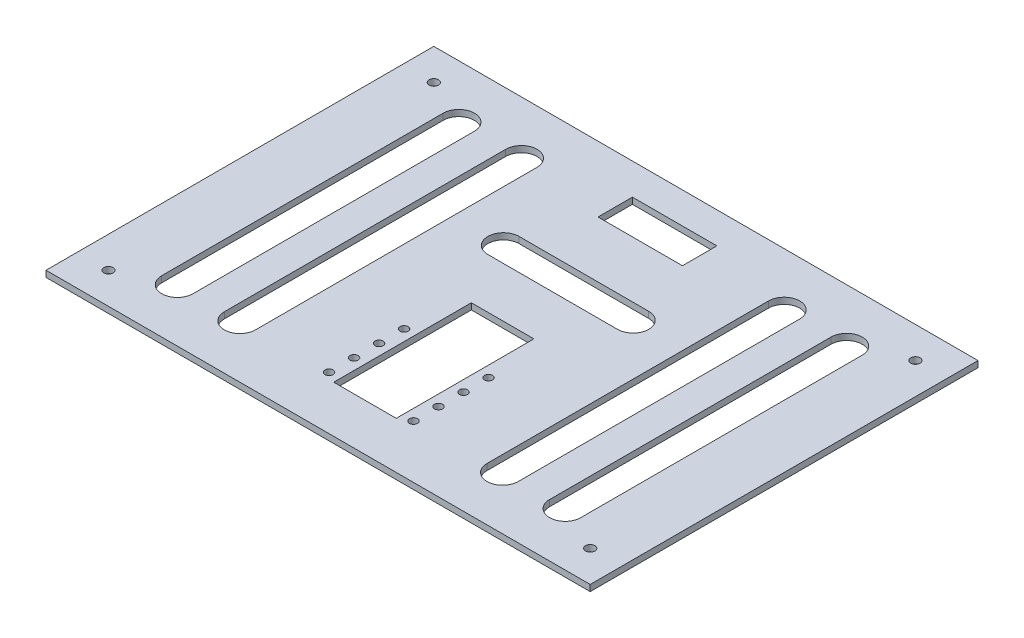
from build123d import *

# Parameters (mm, degrees)
ESBO_O1_W                = 174
ESBO_O1_H                = 124
ESBO_O1_R                = 1.5
RESSALTO_EXTRUS_O1_DEPTH = 2
ESBO_O2_R                = 1.3
ESBO_O2_W                = 20
ESBO_O2_H                = 44
ESBO_O2_W_2              = 27
ESBO_O2_H_2              = 11
CORTE_EXTRUS_O1_DEPTH    = 2


with BuildPart() as part:
    # Esboço1 → Ressalto-extrusão1 (new body)
    with BuildSketch(Plane(origin=(0, 0, 0), x_dir=(1, 0, 0), z_dir=(0, 1, 0))):
        Rectangle(ESBO_O1_W, ESBO_O1_H)
        with Locations(Location((-77, 52, 0), (0, 0, 270))):
            Circle(ESBO_O1_R, mode=Mode.SUBTRACT)
        with Locations(Location((-77, -52, 0), (0, 0, 270))):
            Circle(ESBO_O1_R, mode=Mode.SUBTRACT)
        with Locations(Location((77, -52, 0), (0, 0, 270))):
            Circle(ESBO_O1_R, mode=Mode.SUBTRACT)
        with Locations(Location((77, 52, 0), (0, 0, 270))):
            Circle(ESBO_O1_R, mode=Mode.SUBTRACT)
    extrude(amount=RESSALTO_EXTRUS_O1_DEPTH)

    # Esboço2 → Corte-extrusão1 (cut)
    with BuildSketch(Plane(origin=(0, 2, 0), x_dir=(1, 0, 0), z_dir=(0, 1, 0))):
        with Locations(Location((-13.5, -21, 0), (0, 0, 270))):
            Circle(ESBO_O2_R)
        with Locations(Location((-13.5, -29, 0), (0, 0, 270))):
            Circle(ESBO_O2_R)
        with Locations(Location((-13.5, -37, 0), (0, 0, 270))):
            Circle(ESBO_O2_R)
        with Locations(Location((-13.5, -45, 0), (0, 0, 270))):
            Circle(ESBO_O2_R)
        with Locations(Location((13.5, -37, 0), (0, 0, 90))):
            Circle(ESBO_O2_R)
        with Locations(Location((13.5, -45, 0), (0, 0, 90))):
            Circle(ESBO_O2_R)
        with Locations(Location((13.5, -29, 0), (0, 0, 90))):
            Circle(ESBO_O2_R)
        with Locations(Location((13.5, -21, 0), (0, 0, 90))):
            Circle(ESBO_O2_R)
        with Locations((0, -25)):
            Rectangle(ESBO_O2_W, ESBO_O2_H)
        with BuildLine():
            Line((-37, 45), (-37, -45))
            ThreePointArc((-37, -45), (-42, -50), (-47, -45))
            Line((-47, -45), (-47, 45))
            ThreePointArc((-47, 45), (-42, 50), (-37, 45))
        make_face()
        with BuildLine():
            Line((-57, 45), (-57, -45))
            ThreePointArc((-57, -45), (-62, -50), (-67, -45))
            Line((-67, -45), (-67, 45))
            ThreePointArc((-67, 45), (-62, 50), (-57, 45))
        make_face()
        with BuildLine():
            Line((47, 45), (47, -45))
            ThreePointArc((47, -45), (42, -50), (37, -45))
            Line((37, -45), (37, 45))
            ThreePointArc((37, 45), (42, 50), (47, 45))
        make_face()
        with BuildLine():
            Line((67, 45), (67, -45))
            ThreePointArc((67, -45), (62, -50), (57, -45))
            Line((57, -45), (57, 45))
            ThreePointArc((57, 45), (62, 50), (67, 45))
        make_face()
        with BuildLine():
            Line((-20.724176636, 23), (20.724176636, 23))
            ThreePointArc((20.724176636, 23), (25.724176636, 18), (20.724176636, 13))
            Line((20.724176636, 13), (-20.724176636, 13))
            ThreePointArc((-20.724176636, 13), (-25.724176636, 18), (-20.724176636, 23))
        make_face()
        with Locations((0, 46.5)):
            Rectangle(ESBO_O2_W_2, ESBO_O2_H_2)
    extrude(amount=-CORTE_EXTRUS_O1_DEPTH, mode=Mode.SUBTRACT)


solid = part.part
